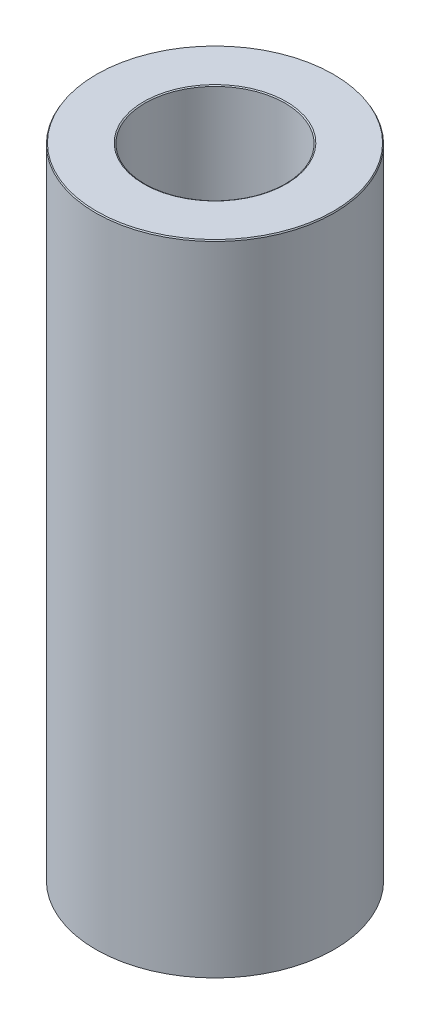
from build123d import *
from OCP.BRepFilletAPI import BRepFilletAPI_MakeChamfer

# Parameters (mm, degrees)
SKETCH1_R           = 32.5
BOSS_EXTRUDE1_DEPTH = 174.344077596
SKETCH2_R           = 19.109579704
CUT_EXTRUDE1_DEPTH  = 181.30074152
CHAMFER1_SIZE       = 0.326411547
CHAMFER1_SIZE2      = 0.199200869


with BuildPart() as part:
    # Sketch1 → Boss-Extrude1 (new body)
    with BuildSketch(Plane(origin=(0, 0, 0), x_dir=(1, 0, 0), z_dir=(0, 1, 0))):
        Circle(SKETCH1_R)
    extrude(amount=BOSS_EXTRUDE1_DEPTH)

    # Sketch2 → Cut-Extrude1 (cut, through all)
    with BuildSketch(Plane(origin=(0, 0, 0), x_dir=(1, 0, 0), z_dir=(0, 1, 0))):
        Circle(SKETCH2_R)
    extrude(amount=CUT_EXTRUDE1_DEPTH, mode=Mode.SUBTRACT)

    # Chamfer1: one chamfer whose edges measure the first distance from different faces: ONE call of the kernel's chamfer builder (chamfer() names one face for all edges)
    chamfer1_edges_1 = [part.edges().sort_by_distance(p)[0] for p in [
        (-19.109579704, 174.344077596, 0),
    ]]
    chamfer1_side_1 = [part.faces().sort_by_distance(p)[0] for p in [
        (-31.580761184, 174.344077596, 0),
    ]]
    chamfer1_edges_2 = [part.edges().sort_by_distance(p)[0] for p in [
        (-19.109579704, 0, 0),
    ]]
    chamfer1_side_2 = [part.faces().sort_by_distance(p)[0] for p in [
        (-19.109579704, 87.172038798, 0),
    ]]
    chamfer1_edges_3 = [part.edges().sort_by_distance(p)[0] for p in [
        (-32.5, 0, 0),
    ]]
    chamfer1_side_3 = [part.faces().sort_by_distance(p)[0] for p in [
        (-31.580761184, 0, 0),
    ]]
    chamfer1_edges_4 = [part.edges().sort_by_distance(p)[0] for p in [
        (-32.5, 174.344077596, 0),
    ]]
    chamfer1_side_4 = [part.faces().sort_by_distance(p)[0] for p in [
        (-32.5, 87.172038798, 0),
    ]]
    chamfer1 = BRepFilletAPI_MakeChamfer(part.part.solid().wrapped)
    for e in chamfer1_edges_1:
        chamfer1.Add(CHAMFER1_SIZE, CHAMFER1_SIZE2, e.wrapped, chamfer1_side_1[0].wrapped)  # the first distance lies on this face
    for e in chamfer1_edges_2:
        chamfer1.Add(CHAMFER1_SIZE, CHAMFER1_SIZE2, e.wrapped, chamfer1_side_2[0].wrapped)  # the first distance lies on this face
    for e in chamfer1_edges_3:
        chamfer1.Add(CHAMFER1_SIZE, CHAMFER1_SIZE2, e.wrapped, chamfer1_side_3[0].wrapped)  # the first distance lies on this face
    for e in chamfer1_edges_4:
        chamfer1.Add(CHAMFER1_SIZE, CHAMFER1_SIZE2, e.wrapped, chamfer1_side_4[0].wrapped)  # the first distance lies on this face
    add(Compound.cast(chamfer1.Shape()), mode=Mode.REPLACE)


solid = part.part
